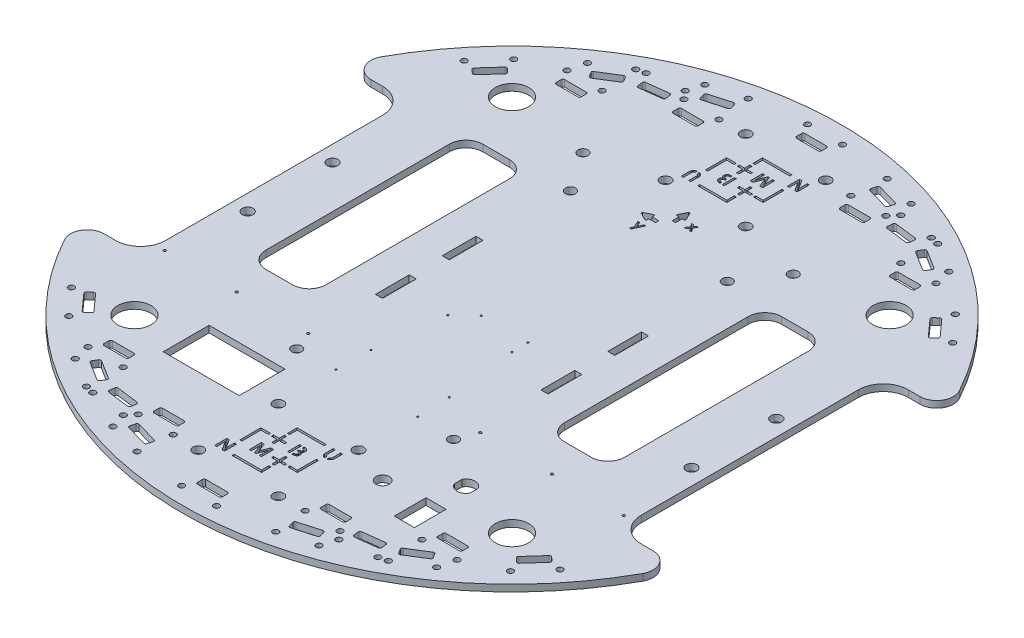
from build123d import *

# Parameters (mm, degrees)
ESQUISSE1_R                     = 197.5
BOSS_EXTRU_1_DEPTH              = 4
ESQUISSE3_R                     = 3.25
ENL_V_MAT_EXTRU_2_DEPTH         = 280.3358194
ENL_V_MAT_EXTRU_5_DEPTH         = 280.3358194
ESQUISSE6_W                     = 4.2
ESQUISSE6_H                     = 20.2
ENL_V_MAT_EXTRU_9_DEPTH         = 280.3358194
ESQUISSE7_R                     = 10
ENL_V_MAT_EXTRU_10_DEPTH        = 280.3358194
SKETCH7_R                       = 3.15
CUT_EXTRUDE3_DEPTH              = 280.3358194
ESQUISSE8_R                     = 1.75
ENL_V_MAT_EXTRU_11_DEPTH        = 280.3358194
MIRROR2_COPY_1_SKETCH_R         = 3.15
MIRROR2_COPY_1_DEPTH            = 280.3358194
MIRROR2_COPY_2_SKETCH_R         = 1.75
MIRROR2_COPY_2_DEPTH            = 280.3358194
MIRROR2_COPY_3_SKETCH_R         = 3.15
MIRROR2_COPY_3_DEPTH            = 280.3358194
SKETCH1_R                       = 1.75
CUT_EXTRUDE1_DEPTH              = 10
CIRPATTERN1_COUNT               = 4
CIRPATTERN1_ANGLE               = 48
CIRPATTERN1_THE_OTHER_WAY_COUNT = 4
CIRPATTERN1_THE_OTHER_WAY_ANGLE = 48
SKETCH_PATTERN2_START           = -1
SKETCH_PATTERN2_OUTLINE_R       = 1.75
SKETCH_PATTERN2_DEPTH           = 6
MIRROR3_COPY_1_SKETCH_R         = 1.75
MIRROR3_COPY_1_DEPTH            = 10
MIRROR3_COPY_2_SKETCH_R         = 1.75
MIRROR3_COPY_2_DEPTH            = 10
MIRROR3_COPY_3_SKETCH_R         = 1.75
MIRROR3_COPY_3_DEPTH            = 10
MIRROR3_COPY_4_SKETCH_R         = 1.75
MIRROR3_COPY_4_DEPTH            = 10
MIRROR3_COPY_5_SKETCH_R         = 1.75
MIRROR3_COPY_5_DEPTH            = 10
MIRROR3_COPY_6_SKETCH_R         = 1.75
MIRROR3_COPY_6_DEPTH            = 10
ESQUISSE9_W                     = 12
ESQUISSE9_H                     = 19
ENL_V_MAT_EXTRU_12_DEPTH        = 268.635012657
SKETCH6_W                       = 1.181022612
SKETCH6_H                       = 7.277439296
CUT_EXTRUDE2_DEPTH              = 268.635012657
CIRPATTERN2_COUNT               = 2
SKETCH9_R                       = 3
CUT_EXTRUDE4_DEPTH              = 268.635012657
SKETCH10_R                      = 0.75
CUT_EXTRUDE5_DEPTH              = 268.635012657
CUT_EXTRUDE6_DEPTH              = 268.635012657
FILLET1_R                       = 0.5
FILLET2_R                       = 10
SKETCH13_R                      = 0.5
CUT_EXTRUDE7_DEPTH              = 10
SKETCH14_W                      = 45.5
SKETCH14_H                      = 27.5
CUT_EXTRUDE8_DEPTH              = 264.5683153
SKETCH15_R                      = 4
CUT_EXTRUDE9_DEPTH              = 264.5683153
SKETCH16_R                      = 3
CUT_EXTRUDE10_DEPTH             = 10


with BuildPart() as part:
    # Esquisse1 → Boss.-Extru.1 (new body)
    with BuildSketch(Plane(origin=(0, 0, 0), x_dir=(1, 0, 0), z_dir=(0, 1, 0))):
        with Locations(Location((0, 0, 0), (0, 0, 270))):
            Circle(ESQUISSE1_R)
    extrude(amount=BOSS_EXTRU_1_DEPTH)

    # Esquisse3 → Enlèv. mat.-Extru.2 (cut, symmetric)
    with BuildSketch(Plane(origin=(0, 0, 0), x_dir=(1, 0, 0), z_dir=(0, 1, 0))):
        with Locations(Location((-132.97, 25.4, 0), (0, 0, 270))):
            Circle(ESQUISSE3_R)
        with Locations(Location((-132.97, -25.4, 0), (0, 0, 270))):
            Circle(ESQUISSE3_R)
        with BuildLine():
            Line((-180.572007797, 80), (-157.5, 80))
            ThreePointArc((-157.5, 80), (-146.893398282, 75.606601718), (-142.5, 65))
            Line((-142.5, 65), (-142.5, -65))
            ThreePointArc((-142.5, -65), (-146.893398282, -75.606601718), (-157.5, -80))
            Line((-157.5, -80), (-180.572007797, -80))
            ThreePointArc((-180.572007797, -80), (-197.5, 0), (-180.572007797, 80))
        make_face()
    enl_v_mat_extru_2 = extrude(amount=ENL_V_MAT_EXTRU_2_DEPTH, both=True, mode=Mode.SUBTRACT)

    # Esquisse4 → Enlèv. mat.-Extru.5 (cut, through all)
    with BuildSketch(Plane(origin=(0, 0, 0), x_dir=(1, 0, 0), z_dir=(0, 1, 0))):
        with BuildLine():
            Line((-107.5, 70), (-107.5, -40))
            ThreePointArc((-107.5, -40), (-104.571067812, -47.071067812), (-97.5, -50))
            Line((-97.5, -50), (-81.5, -50))
            ThreePointArc((-81.5, -50), (-74.428932188, -47.071067812), (-71.5, -40))
            Line((-71.5, -40), (-71.5, 70))
            ThreePointArc((-71.5, 70), (-74.428932188, 77.071067812), (-81.5, 80))
            Line((-81.5, 80), (-97.5, 80))
            ThreePointArc((-97.5, 80), (-104.571067812, 77.071067812), (-107.5, 70))
        make_face()
    enl_v_mat_extru_5 = extrude(amount=ENL_V_MAT_EXTRU_5_DEPTH, mode=Mode.SUBTRACT)

    # Esquisse6 → Enlèv. mat.-Extru.9 (cut, through all)
    with BuildSketch(Plane(origin=(0, 0, 0), x_dir=(1, 0, 0), z_dir=(0, 1, 0))):
        with Locations((-49.6, 20)):
            Rectangle(ESQUISSE6_W, ESQUISSE6_H)
        with Locations((-49.6, -20)):
            Rectangle(ESQUISSE6_W, ESQUISSE6_H)
    enl_v_mat_extru_9 = extrude(amount=ENL_V_MAT_EXTRU_9_DEPTH, mode=Mode.SUBTRACT)

    # Esquisse7 → Enlèv. mat.-Extru.10 (cut, through all)
    with BuildSketch(Plane(origin=(0, 0, 0), x_dir=(1, 0, 0), z_dir=(0, 1, 0))):
        with Locations(Location((-113.13708499, 113.13708499, 0), (0, 0, 270))):
            Circle(ESQUISSE7_R)
        with Locations(Location((-113.13708499, -113.13708499, 0), (0, 0, 90))):
            Circle(ESQUISSE7_R)
    enl_v_mat_extru_10 = extrude(amount=ENL_V_MAT_EXTRU_10_DEPTH, mode=Mode.SUBTRACT)

    # Sketch7 → Cut-Extrude3 (cut, through all)
    with BuildSketch(Plane(origin=(0, 4, 0), x_dir=(1, 0, 0), z_dir=(0, 1, 0))):
        with Locations(Location((-24, 164, 0), (0, 0, 270))):
            Circle(SKETCH7_R)
        with Locations(Location((24, 164, 0), (0, 0, 270))):
            Circle(SKETCH7_R)
        with Locations(Location((-24, 116, 0), (0, 0, 270))):
            Circle(SKETCH7_R)
        with Locations(Location((24, 116, 0), (0, 0, 270))):
            Circle(SKETCH7_R)
    cut_extrude3 = extrude(amount=-CUT_EXTRUDE3_DEPTH, mode=Mode.SUBTRACT)

    # Esquisse8 → Enlèv. mat.-Extru.11 (cut, through all)
    with BuildSketch(Plane(origin=(0, 4, 0), x_dir=(1, 0, 0), z_dir=(0, 1, 0))):
        with Locations(Location((-85.421734592, 165.776408015, 0), (0, 0, 270))):
            Circle(ESQUISSE8_R)
        with Locations(Location((-64.578265408, 168.335664227, 0), (0, 0, 270))):
            Circle(ESQUISSE8_R)
        with BuildLine():
            Line((-80.17192188, 155.842150797), (-67.268821909, 157.426452261))
            ThreePointArc((-67.268821909, 157.426452261), (-66.602680498, 157.803336937), (-66.3981451, 158.540867756))
            Line((-66.3981451, 158.540867756), (-66.763753131, 161.518506211))
            ThreePointArc((-66.763753131, 161.518506211), (-67.140637807, 162.184647621), (-67.878168626, 162.389183019))
            Line((-67.878168626, 162.389183019), (-80.781268597, 160.804881555))
            ThreePointArc((-80.781268597, 160.804881555), (-81.447410007, 160.427996879), (-81.651945405, 159.69046606))
            Line((-81.651945405, 159.69046606), (-81.286337375, 156.712827605))
            ThreePointArc((-81.286337375, 156.712827605), (-80.909452699, 156.046686195), (-80.17192188, 155.842150797))
        make_face()
    enl_v_mat_extru_11 = extrude(amount=-ENL_V_MAT_EXTRU_11_DEPTH, mode=Mode.SUBTRACT)

    # Mirror1: Cut-Extrude3, Enlèv. mat.-Extru.11 across plane
    add(cut_extrude3.mirror(Plane.XY), mode=Mode.SUBTRACT)
    add(enl_v_mat_extru_11.mirror(Plane.XY), mode=Mode.SUBTRACT)

    # Mirror2: Enlèv. mat.-Extru.2, Enlèv. mat.-Extru.5, Enlèv. mat.-Extru.9, Enlèv. mat.-Extru.10, Enlèv. mat.-Extru.11 across plane
    add(enl_v_mat_extru_2.mirror(Plane(origin=(0, 0, 0), x_dir=(0, 0, 1), z_dir=(1, 0, 0))), mode=Mode.SUBTRACT)
    add(enl_v_mat_extru_5.mirror(Plane(origin=(0, 0, 0), x_dir=(0, 0, 1), z_dir=(1, 0, 0))), mode=Mode.SUBTRACT)
    add(enl_v_mat_extru_9.mirror(Plane(origin=(0, 0, 0), x_dir=(0, 0, 1), z_dir=(1, 0, 0))), mode=Mode.SUBTRACT)
    add(enl_v_mat_extru_10.mirror(Plane(origin=(0, 0, 0), x_dir=(0, 0, 1), z_dir=(1, 0, 0))), mode=Mode.SUBTRACT)
    add(enl_v_mat_extru_11.mirror(Plane(origin=(0, 0, 0), x_dir=(0, 0, 1), z_dir=(1, 0, 0))), mode=Mode.SUBTRACT)

    # Mirror2 copy 1 sketch → Mirror2 copy 1 (cut, through all)
    with BuildSketch(Plane(origin=(0, 4, 0), x_dir=(-1, 0, 0), z_dir=(0, 1, 0))):
        with Locations(Location((-24, 164, 0), (0, 0, 270))):
            Circle(MIRROR2_COPY_1_SKETCH_R)
        with Locations(Location((24, 164, 0), (0, 0, 270))):
            Circle(MIRROR2_COPY_1_SKETCH_R)
        with Locations(Location((-24, 116, 0), (0, 0, 270))):
            Circle(MIRROR2_COPY_1_SKETCH_R)
        with Locations(Location((24, 116, 0), (0, 0, 270))):
            Circle(MIRROR2_COPY_1_SKETCH_R)
    extrude(amount=-MIRROR2_COPY_1_DEPTH, mode=Mode.SUBTRACT)

    # Mirror2 copy 2 sketch → Mirror2 copy 2 (cut, through all)
    with BuildSketch(Plane(origin=(0, 4, 0), x_dir=(-1, 0, 0), z_dir=(0, 1, 0))):
        with Locations(Location((-85.421734592, 165.776408015, 0), (0, 0, 270))):
            Circle(MIRROR2_COPY_2_SKETCH_R)
        with Locations(Location((-64.578265408, 168.335664227, 0), (0, 0, 270))):
            Circle(MIRROR2_COPY_2_SKETCH_R)
        with BuildLine():
            Line((-80.17192188, 155.842150797), (-67.268821909, 157.426452261))
            ThreePointArc((-67.268821909, 157.426452261), (-66.602680498, 157.803336937), (-66.3981451, 158.540867756))
            Line((-66.3981451, 158.540867756), (-66.763753131, 161.518506211))
            ThreePointArc((-66.763753131, 161.518506211), (-67.140637807, 162.184647621), (-67.878168626, 162.389183019))
            Line((-67.878168626, 162.389183019), (-80.781268597, 160.804881555))
            ThreePointArc((-80.781268597, 160.804881555), (-81.447410007, 160.427996879), (-81.651945405, 159.69046606))
            Line((-81.651945405, 159.69046606), (-81.286337375, 156.712827605))
            ThreePointArc((-81.286337375, 156.712827605), (-80.909452699, 156.046686195), (-80.17192188, 155.842150797))
        make_face()
    extrude(amount=-MIRROR2_COPY_2_DEPTH, mode=Mode.SUBTRACT)

    # Mirror2 copy 3 sketch → Mirror2 copy 3 (cut, through all)
    with BuildSketch(Plane(origin=(0, 4, 0), x_dir=(-1, 0, 0), z_dir=(0, 1, 0))):
        with Locations((-24, -164)):
            Circle(MIRROR2_COPY_3_SKETCH_R)
        with Locations((24, -164)):
            Circle(MIRROR2_COPY_3_SKETCH_R)
        with Locations((-24, -116)):
            Circle(MIRROR2_COPY_3_SKETCH_R)
        with Locations((24, -116)):
            Circle(MIRROR2_COPY_3_SKETCH_R)
    extrude(amount=-MIRROR2_COPY_3_DEPTH, mode=Mode.SUBTRACT)

    # Sketch1 → Cut-Extrude1 (cut)
    with BuildSketch(Plane(origin=(0, 4, 0), x_dir=(1, 0, 0), z_dir=(0, 1, 0))):
        with Locations(Location((-10.5, 187.5, 0), (0, 0, 270))):
            Circle(SKETCH1_R)
        with Locations(Location((10.5, 187.5, 0), (0, 0, 270))):
            Circle(SKETCH1_R)
        with BuildLine():
            Line((-6.5, 177), (6.5, 177))
            ThreePointArc((6.5, 177), (7.207106781, 177.292893219), (7.5, 178))
            Line((7.5, 178), (7.5, 181))
            ThreePointArc((7.5, 181), (7.207106781, 181.707106781), (6.5, 182))
            Line((6.5, 182), (-6.5, 182))
            ThreePointArc((-6.5, 182), (-7.207106781, 181.707106781), (-7.5, 181))
            Line((-7.5, 181), (-7.5, 178))
            ThreePointArc((-7.5, 178), (-7.207106781, 177.292893219), (-6.5, 177))
        make_face()
    cut_extrude1 = extrude(amount=-CUT_EXTRUDE1_DEPTH, mode=Mode.SUBTRACT)

    # CirPattern1: Cut-Extrude1 ×4 about axis
    cirpattern1_axis = Axis((0, 0, 0), (0, -1, 0))
    for i in range(1, CIRPATTERN1_COUNT):
        add(cut_extrude1.rotate(cirpattern1_axis, i * CIRPATTERN1_ANGLE / (CIRPATTERN1_COUNT - 1)), mode=Mode.SUBTRACT)

    # CirPattern1 the other way: Cut-Extrude1 ×4 about axis
    cirpattern1_the_other_way_axis = Axis((0, 0, 0), (0, 1, 0))
    for i in range(1, CIRPATTERN1_THE_OTHER_WAY_COUNT):
        add(cut_extrude1.rotate(cirpattern1_the_other_way_axis, i * CIRPATTERN1_THE_OTHER_WAY_ANGLE / (CIRPATTERN1_THE_OTHER_WAY_COUNT - 1)), mode=Mode.SUBTRACT)

    # Sketch-Pattern2: read off the stored shape, not the designer's step
    # Sketch-Pattern2 outline → Sketch-Pattern2 (cut)
    with BuildSketch(Plane(origin=(0, 0, 0), x_dir=(1, 0, 0), z_dir=(0, 1, 0)).offset(SKETCH_PATTERN2_START)):
        with BuildLine():
            ThreePointArc((-106.5, 138), (-107.207106781, 137.707106781), (-107.5, 137))
            Line((-107.5, 137), (-107.5, 134))
            ThreePointArc((-107.5, 134), (-107.207106781, 133.292893219), (-106.5, 133))
            Line((-106.5, 133), (-93.5, 133))
            ThreePointArc((-93.5, 133), (-92.792893219, 133.292893219), (-92.5, 134))
            Line((-92.5, 134), (-92.5, 137))
            ThreePointArc((-92.5, 137), (-92.792893219, 137.707106781), (-93.5, 138))
            Line((-93.5, 138), (-106.5, 138))
        make_face()
        with BuildLine():
            ThreePointArc((106.5, 133), (107.207106781, 133.292893219), (107.5, 134))
            Line((107.5, 134), (107.5, 137))
            ThreePointArc((107.5, 137), (107.207106781, 137.707106781), (106.5, 138))
            Line((106.5, 138), (93.5, 138))
            ThreePointArc((93.5, 138), (92.792893219, 137.707106781), (92.5, 137))
            Line((92.5, 137), (92.5, 134))
            ThreePointArc((92.5, 134), (92.792893219, 133.292893219), (93.5, 133))
            Line((93.5, 133), (106.5, 133))
        make_face()
        with Locations((39.5, 163.5)):
            Circle(SKETCH_PATTERN2_OUTLINE_R)
        with BuildLine():
            Line((-42.5, 154), (-42.5, 157))
            ThreePointArc((-42.5, 157), (-42.792893219, 157.707106781), (-43.5, 158))
            Line((-43.5, 158), (-56.5, 158))
            ThreePointArc((-56.5, 158), (-57.207106781, 157.707106781), (-57.5, 157))
            Line((-57.5, 157), (-57.5, 154))
            ThreePointArc((-57.5, 154), (-57.207106781, 153.292893219), (-56.5, 153))
            Line((-56.5, 153), (-43.5, 153))
            ThreePointArc((-43.5, 153), (-42.792893219, 153.292893219), (-42.5, 154))
        make_face()
        with BuildLine():
            ThreePointArc((42.5, 154), (42.792893219, 153.292893219), (43.5, 153))
            Line((43.5, 153), (56.5, 153))
            ThreePointArc((56.5, 153), (57.207106781, 153.292893219), (57.5, 154))
            Line((57.5, 154), (57.5, 157))
            ThreePointArc((57.5, 157), (57.207106781, 157.707106781), (56.5, 158))
            Line((56.5, 158), (43.5, 158))
            ThreePointArc((43.5, 158), (42.792893219, 157.707106781), (42.5, 157))
            Line((42.5, 157), (42.5, 154))
        make_face()
        with Locations((-39.5, 163.5)):
            Circle(SKETCH_PATTERN2_OUTLINE_R)
        with Locations((-60.5, 163.5)):
            Circle(SKETCH_PATTERN2_OUTLINE_R)
        with Locations((60.5, 163.5)):
            Circle(SKETCH_PATTERN2_OUTLINE_R)
        with Locations((-89.5, 143.5)):
            Circle(SKETCH_PATTERN2_OUTLINE_R)
        with Locations((89.5, 143.5)):
            Circle(SKETCH_PATTERN2_OUTLINE_R)
        with Locations((110.5, 143.5)):
            Circle(SKETCH_PATTERN2_OUTLINE_R)
        with Locations((-110.5, 143.5)):
            Circle(SKETCH_PATTERN2_OUTLINE_R)
    sketch_pattern2 = extrude(amount=SKETCH_PATTERN2_DEPTH, mode=Mode.SUBTRACT)

    # Mirror3: Cut-Extrude1, Sketch-Pattern2 across plane
    add(cut_extrude1.mirror(Plane.XY), mode=Mode.SUBTRACT)
    add(sketch_pattern2.mirror(Plane.XY), mode=Mode.SUBTRACT)

    # Mirror3 copy 1 sketch → Mirror3 copy 1 (cut)
    with BuildSketch(Plane(origin=(0, 4, 0), x_dir=(0.9612616959383187, 0, -0.2756373558169998), z_dir=(0, 1, 0))):
        with Locations((-10.5, -187.5)):
            Circle(MIRROR3_COPY_1_SKETCH_R)
        with Locations((10.5, -187.5)):
            Circle(MIRROR3_COPY_1_SKETCH_R)
        with BuildLine():
            Line((-6.5, -177), (6.5, -177))
            ThreePointArc((6.5, -177), (7.207106781, -177.292893219), (7.5, -178))
            Line((7.5, -178), (7.5, -181))
            ThreePointArc((7.5, -181), (7.207106781, -181.707106781), (6.5, -182))
            Line((6.5, -182), (-6.5, -182))
            ThreePointArc((-6.5, -182), (-7.207106781, -181.707106781), (-7.5, -181))
            Line((-7.5, -181), (-7.5, -178))
            ThreePointArc((-7.5, -178), (-7.207106781, -177.292893219), (-6.5, -177))
        make_face()
    extrude(amount=-MIRROR3_COPY_1_DEPTH, mode=Mode.SUBTRACT)

    # Mirror3 copy 2 sketch → Mirror3 copy 2 (cut)
    with BuildSketch(Plane(origin=(0, 4, 0), x_dir=(0.8480480961564253, 0, -0.529919264233206), z_dir=(0, 1, 0))):
        with Locations((-10.5, -187.5)):
            Circle(MIRROR3_COPY_2_SKETCH_R)
        with Locations((10.5, -187.5)):
            Circle(MIRROR3_COPY_2_SKETCH_R)
        with BuildLine():
            Line((-6.5, -177), (6.5, -177))
            ThreePointArc((6.5, -177), (7.207106781, -177.292893219), (7.5, -178))
            Line((7.5, -178), (7.5, -181))
            ThreePointArc((7.5, -181), (7.207106781, -181.707106781), (6.5, -182))
            Line((6.5, -182), (-6.5, -182))
            ThreePointArc((-6.5, -182), (-7.207106781, -181.707106781), (-7.5, -181))
            Line((-7.5, -181), (-7.5, -178))
            ThreePointArc((-7.5, -178), (-7.207106781, -177.292893219), (-6.5, -177))
        make_face()
    extrude(amount=-MIRROR3_COPY_2_DEPTH, mode=Mode.SUBTRACT)

    # Mirror3 copy 3 sketch → Mirror3 copy 3 (cut)
    with BuildSketch(Plane(origin=(0, 4, 0), x_dir=(0.6691306063588569, 0, -0.7431448254773955), z_dir=(0, 1, 0))):
        with Locations((-10.5, -187.5)):
            Circle(MIRROR3_COPY_3_SKETCH_R)
        with Locations((10.5, -187.5)):
            Circle(MIRROR3_COPY_3_SKETCH_R)
        with BuildLine():
            Line((-6.5, -177), (6.5, -177))
            ThreePointArc((6.5, -177), (7.207106781, -177.292893219), (7.5, -178))
            Line((7.5, -178), (7.5, -181))
            ThreePointArc((7.5, -181), (7.207106781, -181.707106781), (6.5, -182))
            Line((6.5, -182), (-6.5, -182))
            ThreePointArc((-6.5, -182), (-7.207106781, -181.707106781), (-7.5, -181))
            Line((-7.5, -181), (-7.5, -178))
            ThreePointArc((-7.5, -178), (-7.207106781, -177.292893219), (-6.5, -177))
        make_face()
    extrude(amount=-MIRROR3_COPY_3_DEPTH, mode=Mode.SUBTRACT)

    # Mirror3 copy 4 sketch → Mirror3 copy 4 (cut)
    with BuildSketch(Plane(origin=(0, 4, 0), x_dir=(0.9612616959383187, 0, 0.2756373558169998), z_dir=(0, 1, 0))):
        with Locations((-10.5, -187.5)):
            Circle(MIRROR3_COPY_4_SKETCH_R)
        with Locations((10.5, -187.5)):
            Circle(MIRROR3_COPY_4_SKETCH_R)
        with BuildLine():
            Line((-6.5, -177), (6.5, -177))
            ThreePointArc((6.5, -177), (7.207106781, -177.292893219), (7.5, -178))
            Line((7.5, -178), (7.5, -181))
            ThreePointArc((7.5, -181), (7.207106781, -181.707106781), (6.5, -182))
            Line((6.5, -182), (-6.5, -182))
            ThreePointArc((-6.5, -182), (-7.207106781, -181.707106781), (-7.5, -181))
            Line((-7.5, -181), (-7.5, -178))
            ThreePointArc((-7.5, -178), (-7.207106781, -177.292893219), (-6.5, -177))
        make_face()
    extrude(amount=-MIRROR3_COPY_4_DEPTH, mode=Mode.SUBTRACT)

    # Mirror3 copy 5 sketch → Mirror3 copy 5 (cut)
    with BuildSketch(Plane(origin=(0, 4, 0), x_dir=(0.8480480961564253, 0, 0.529919264233206), z_dir=(0, 1, 0))):
        with Locations((-10.5, -187.5)):
            Circle(MIRROR3_COPY_5_SKETCH_R)
        with Locations((10.5, -187.5)):
            Circle(MIRROR3_COPY_5_SKETCH_R)
        with BuildLine():
            Line((-6.5, -177), (6.5, -177))
            ThreePointArc((6.5, -177), (7.207106781, -177.292893219), (7.5, -178))
            Line((7.5, -178), (7.5, -181))
            ThreePointArc((7.5, -181), (7.207106781, -181.707106781), (6.5, -182))
            Line((6.5, -182), (-6.5, -182))
            ThreePointArc((-6.5, -182), (-7.207106781, -181.707106781), (-7.5, -181))
            Line((-7.5, -181), (-7.5, -178))
            ThreePointArc((-7.5, -178), (-7.207106781, -177.292893219), (-6.5, -177))
        make_face()
    extrude(amount=-MIRROR3_COPY_5_DEPTH, mode=Mode.SUBTRACT)

    # Mirror3 copy 6 sketch → Mirror3 copy 6 (cut)
    with BuildSketch(Plane(origin=(0, 4, 0), x_dir=(0.6691306063588569, 0, 0.7431448254773955), z_dir=(0, 1, 0))):
        with Locations((-10.5, -187.5)):
            Circle(MIRROR3_COPY_6_SKETCH_R)
        with Locations((10.5, -187.5)):
            Circle(MIRROR3_COPY_6_SKETCH_R)
        with BuildLine():
            Line((-6.5, -177), (6.5, -177))
            ThreePointArc((6.5, -177), (7.207106781, -177.292893219), (7.5, -178))
            Line((7.5, -178), (7.5, -181))
            ThreePointArc((7.5, -181), (7.207106781, -181.707106781), (6.5, -182))
            Line((6.5, -182), (-6.5, -182))
            ThreePointArc((-6.5, -182), (-7.207106781, -181.707106781), (-7.5, -181))
            Line((-7.5, -181), (-7.5, -178))
            ThreePointArc((-7.5, -178), (-7.207106781, -177.292893219), (-6.5, -177))
        make_face()
    extrude(amount=-MIRROR3_COPY_6_DEPTH, mode=Mode.SUBTRACT)

    # Esquisse9 → Enlèv. mat.-Extru.12 (cut, through all)
    with BuildSketch(Plane(origin=(0, 4, 0), x_dir=(1, 0, 0), z_dir=(0, 1, 0))):
        with Locations((75, -130)):
            Rectangle(ESQUISSE9_W, ESQUISSE9_H)
        with BuildLine():
            Line((70.2, -104.747220505), (70.2, -100.252779495))
            ThreePointArc((70.2, -100.252779495), (75, -97.2), (79.8, -100.252779495))
            Line((79.8, -100.252779495), (79.8, -104.747220505))
            ThreePointArc((79.8, -104.747220505), (75, -107.8), (70.2, -104.747220505))
        make_face()
    extrude(amount=-ENL_V_MAT_EXTRU_12_DEPTH, mode=Mode.SUBTRACT)

    # Sketch6 → Cut-Extrude2 (cut, through all)
    with BuildSketch(Plane(origin=(0, 4, 0), x_dir=(1, 0, 0), z_dir=(0, 1, 0))):
        Polygon((11.519766302, -122.80203115), (11.519766302, -124.025714869), (-4.660051768, -124.025714869), (-4.660051768, -128.614528818), (-5.917726702, -128.614528818), (-5.917726702, -122.80203115), align=None)
        Polygon((-5.917726702, -130.476743677), (-5.917726702, -133.664727405), (-9.290826186, -133.664727405), (-9.290826186, -134.904498855), (-5.917726702, -134.904498855), (-5.917726702, -138.026066256), (-4.660051768, -138.026066256), (-4.660051768, -134.904498855), (-1.361090594, -134.904498855), (-1.361090594, -133.664727405), (-4.660051768, -133.664727405), (-4.660051768, -130.476743677), align=None)
        Polygon((-11.128344585, -133.664727405), (-16.795871213, -133.664727405), (-16.795871213, -146.211656181), (-15.585644272, -146.211656181), (-15.585644272, -134.852866665), (-11.128344585, -134.852866665), align=None)
        Polygon((16.137485702, -133.349809858), (17.397641857, -133.349809858), (17.397641857, -145.951652302), (11.670523323, -145.951652302), (11.670523323, -144.756342122), (16.137485702, -144.756342122), align=None)
        Polygon((9.83058755, -144.756342122), (6.597712883, -144.756342122), (6.597712883, -141.20957303), (5.300009672, -141.20957303), (5.300009672, -144.756342122), (1.907767945, -144.756342122), (1.907767945, -145.951652302), (5.300009672, -145.951652302), (5.300009672, -149.132392635), (6.597712883, -149.132392635), (6.597712883, -145.951652302), (9.83058755, -145.951652302), align=None)
        Polygon((5.300009672, -150.929471934), (6.597712883, -150.929471934), (6.597712883, -156.666012655), (-11.052697242, -156.666012655), (-11.052697242, -155.420025055), (5.300009672, -155.420025055), align=None)
        Polygon((15.693130377, -122.80203115), (16.924718803, -122.80203115), (16.924718803, -127.88222269), (17.093141152, -128.250646578), (17.303669088, -128.482227308), (17.494668415, -128.692326567), (17.756304151, -128.850651196), (17.893332421, -128.899666217), (17.893332421, -130.101840711), (17.602589133, -130.101840711), (17.303669088, -129.994916993), (16.924718803, -129.827431316), (16.524552223, -129.500753464), (16.23852433, -129.186122782), (15.982266989, -128.801662861), (15.82704979, -128.46212524), (15.693130377, -128.003896287), align=None)
        Polygon((19.257785553, -128.935766909), (19.420480408, -128.861392118), (19.566812274, -128.794497551), (19.679200356, -128.692326567), (19.794754949, -128.587276938), (19.94236143, -128.406465228), (20.058270828, -128.215365771), (20.142037206, -128.003896287), (20.162412811, -127.832757181), (20.162412811, -122.80203115), (21.411108564, -122.80203115), (21.411108564, -127.918326734), (21.342246091, -128.268024174), (21.186134495, -128.662130252), (20.96089049, -129.082620492), (20.567823476, -129.500753464), (20.234083063, -129.756936365), (19.832512045, -129.977846216), (19.465590856, -130.079017733), (19.257785553, -130.101840711), align=None)
        with Locations((4.156669011, -134.387346608)):
            Rectangle(SKETCH6_W, SKETCH6_H)
        Polygon((6.139125532, -130.74862696), (6.139125532, -131.87291416), (7.006954009, -131.87291416), (7.335321541, -132.037097925), (7.558142366, -132.283373574), (7.675416484, -132.588286282), (7.675416484, -132.987018285), (7.645551851, -133.256660633), (7.49310917, -133.450678591), (7.281552182, -133.642087294), (7.035781126, -133.783280805), (6.139125532, -133.783280805), (6.139125532, -134.852866665), (6.855621593, -134.852866665), (7.158666654, -134.904498855), (7.49310917, -135.119538768), (7.660484168, -135.362837653), (7.828467933, -135.655241654), (7.8598813, -136.01163468), (7.821203579, -136.360848798), (7.660484168, -136.682287621), (7.369696137, -136.882332295), (6.982292684, -137.001098651), (6.497373563, -137.01590122), (6.139125532, -137.01590122), (6.139125532, -138.026066256), (7.325887912, -138.026066256), (7.821203579, -137.915005948), (8.313827424, -137.631997481), (8.726741505, -137.25840855), (8.933972495, -136.84394657), (9.03495015, -136.495279078), (9.069178034, -136.186241739), (9.069178034, -135.693886644), (9.015928534, -135.456400253), (8.863669453, -135.060526642), (8.675833863, -134.824616075), (8.434558839, -134.591473917), (8.145299051, -134.364198369), (8.382254607, -134.127242813), (8.589676653, -133.88051867), (8.761172417, -133.588340702), (8.863669453, -133.232645784), (8.895135171, -132.999564117), (8.895135171, -132.471281636), (8.794390015, -132.020221515), (8.589676653, -131.576191232), (8.253142819, -131.239657398), (7.962394668, -131.069000874), (7.49310917, -130.847578509), (7.075851, -130.74862696), align=None)
        Polygon((-7.734236394, -148.495925375), (-8.960160244, -148.495925375), (-8.960160244, -141.151334741), (-7.288447447, -141.151334741), (-5.34216997, -146.211656181), (-3.363078746, -141.151334741), (-1.631971062, -141.151334741), (-1.631971062, -148.495857621), (-2.880654969, -148.495857621), (-2.880654969, -143.436985857), (-4.859179224, -148.495857621), (-5.73149172, -148.495857621), (-7.734236394, -143.288721468), align=None)
        Polygon((-20.252608434, -156.666012655), (-21.487797003, -156.666012655), (-21.487797003, -149.367193529), (-20.078415174, -149.367193529), (-16.795871213, -154.466305315), (-16.795871213, -149.367193529), (-15.585644272, -149.367193529), (-15.585644272, -156.666012655), (-16.990443751, -156.666012655), (-20.252608434, -151.536691401), align=None)
    cut_extrude2 = extrude(amount=-CUT_EXTRUDE2_DEPTH, mode=Mode.SUBTRACT)

    # CirPattern2: Cut-Extrude2 ×2 about axis
    cirpattern2_axis = Axis((0, 0, 0), (0, 1, 0))
    for i in range(1, CIRPATTERN2_COUNT):
        add(cut_extrude2.rotate(cirpattern2_axis, i * 360 / CIRPATTERN2_COUNT), mode=Mode.SUBTRACT)

    # Sketch9 → Cut-Extrude4 (cut, through all)
    with BuildSketch(Plane(origin=(0, 4, 0), x_dir=(1, 0, 0), z_dir=(0, 1, 0))):
        with Locations(Location((-47, 82, 0), (0, 0, 270))):
            Circle(SKETCH9_R)
        with Locations(Location((47, 82, 0), (0, 0, 270))):
            Circle(SKETCH9_R)
        with Locations(Location((47, -82, 0), (0, 0, 270))):
            Circle(SKETCH9_R)
        with Locations(Location((-47, -82, 0), (0, 0, 270))):
            Circle(SKETCH9_R)
    extrude(amount=-CUT_EXTRUDE4_DEPTH, mode=Mode.SUBTRACT)

    # Sketch10 → Cut-Extrude5 (cut, through all)
    with BuildSketch(Plane.XZ):
        with Locations(Location((51.5, 70.5, 0), (0, 0, 270))):
            Circle(SKETCH10_R)
        with Locations(Location((137.5, 70.5, 0), (0, 0, 270))):
            Circle(SKETCH10_R)
        with Locations(Location((94.5, 70.5, 0), (0, 0, 270))):
            Circle(SKETCH10_R)
    cut_extrude5 = extrude(amount=-CUT_EXTRUDE5_DEPTH, mode=Mode.SUBTRACT)

    # Mirror4: Cut-Extrude5 across plane
    add(cut_extrude5.mirror(Plane(origin=(0, 0, 0), x_dir=(0, 0, 1), z_dir=(1, 0, 0))), mode=Mode.SUBTRACT)

    # Sketch11 → Cut-Extrude6 (cut, through all)
    with BuildSketch(Plane.XZ):
        Polygon((1, -97), (-1, -97), (-1, -101), (-3, -101), (0, -107), (3, -101), (1, -101), align=None)
        Polygon((-5, -93), (-5, -91), (-9, -91), (-9, -89), (-15, -92), (-9, -95), (-9, -93), align=None)
        Polygon((6.219951923, -101.384615385), (7.435096154, -101.384615385), (8.301682692, -100.189903846), (9.164663462, -101.384615385), (10.379807692, -101.384615385), (8.911057692, -99.349759615), (10.615384615, -97), (9.400240385, -97), (8.305288462, -98.509615385), (7.215144231, -97), (6, -97), (7.695913462, -99.349759615), align=None)
        Polygon((-10.895741659, -86.384615385), (-9.817616659, -86.384615385), (-8.620501275, -83.563701923), (-7.295982044, -86.384615385), (-6.201030121, -86.384615385), (-9.019539736, -80.384615385), (-10.114491659, -80.384615385), (-9.187808967, -82.356971154), align=None)
    extrude(amount=-CUT_EXTRUDE6_DEPTH, mode=Mode.SUBTRACT)

    # Fillet1
    fillet1_edges = [part.edges().sort_by_distance(p)[0] for p in [
        (-5, 2, -93),
        (-9, 2, -95),
        (-15, 2, -92),
        (-9, 2, -89),
        (-5, 2, -91),
        (1, 2, -97),
        (3, 2, -101),
        (0, 2, -107),
        (-3, 2, -101),
        (-1, 2, -97),
    ]]
    fillet(fillet1_edges, radius=FILLET1_R)

    # Fillet2
    fillet2_edges = [part.edges().sort_by_distance(p)[0] for p in [
        (-180.572007797, 2, -80),
        (-180.572007797, 2, 80),
        (180.572007797, 2, 80),
        (180.572007797, 2, -80),
    ]]
    fillet(fillet2_edges, radius=FILLET2_R)

    # Sketch13 → Cut-Extrude7 (cut)
    with BuildSketch(Plane(origin=(0, 4, 0), x_dir=(1, 0, 0), z_dir=(0, 1, 0))):
        with Locations(Location((-8.93, -9.5, 0), (0, 0, 270))):
            Circle(SKETCH13_R)
        with Locations(Location((19, -9.5, 0), (0, 0, 270))):
            Circle(SKETCH13_R)
        with Locations(Location((23.75, -61.43, 0), (0, 0, 270))):
            Circle(SKETCH13_R)
        with Locations(Location((-24.136432316, -60.29, 0), (0, 0, 270))):
            Circle(SKETCH13_R)
        with Locations(Location((-19.2, -19.2, 0), (0, 0, 270))):
            Circle(SKETCH13_R)
        with Locations(Location((19.2, -19.2, 0), (0, 0, 270))):
            Circle(SKETCH13_R)
        with Locations(Location((-24.5, -81, 0), (0, 0, 270))):
            Circle(SKETCH13_R)
        with Locations(Location((24.5, -81, 0), (0, 0, 270))):
            Circle(SKETCH13_R)
    extrude(amount=-CUT_EXTRUDE7_DEPTH, mode=Mode.SUBTRACT)

    # Sketch14 → Cut-Extrude8 (cut, through all)
    with BuildSketch(Plane(origin=(0, 4, 0), x_dir=(1, 0, 0), z_dir=(0, 1, 0))):
        with Locations((-62.75, -109.75)):
            Rectangle(SKETCH14_W, SKETCH14_H)
    extrude(amount=-CUT_EXTRUDE8_DEPTH, mode=Mode.SUBTRACT)

    # Sketch15 → Cut-Extrude9 (cut, through all)
    with BuildSketch(Plane.XZ):
        with Locations(Location((47, 124.5, 0), (0, 0, 270))):
            Circle(SKETCH15_R)
    extrude(amount=-CUT_EXTRUDE9_DEPTH, mode=Mode.SUBTRACT)

    # Sketch16 → Cut-Extrude10 (cut)
    with BuildSketch(Plane.XZ):
        with Locations(Location((63, -105.5, 0), (0, 0, 270))):
            Circle(SKETCH16_R)
        with Locations(Location((-63, -105.5, 0), (0, 0, 270))):
            Circle(SKETCH16_R)
    extrude(amount=-CUT_EXTRUDE10_DEPTH, mode=Mode.SUBTRACT)


solid = part.part
